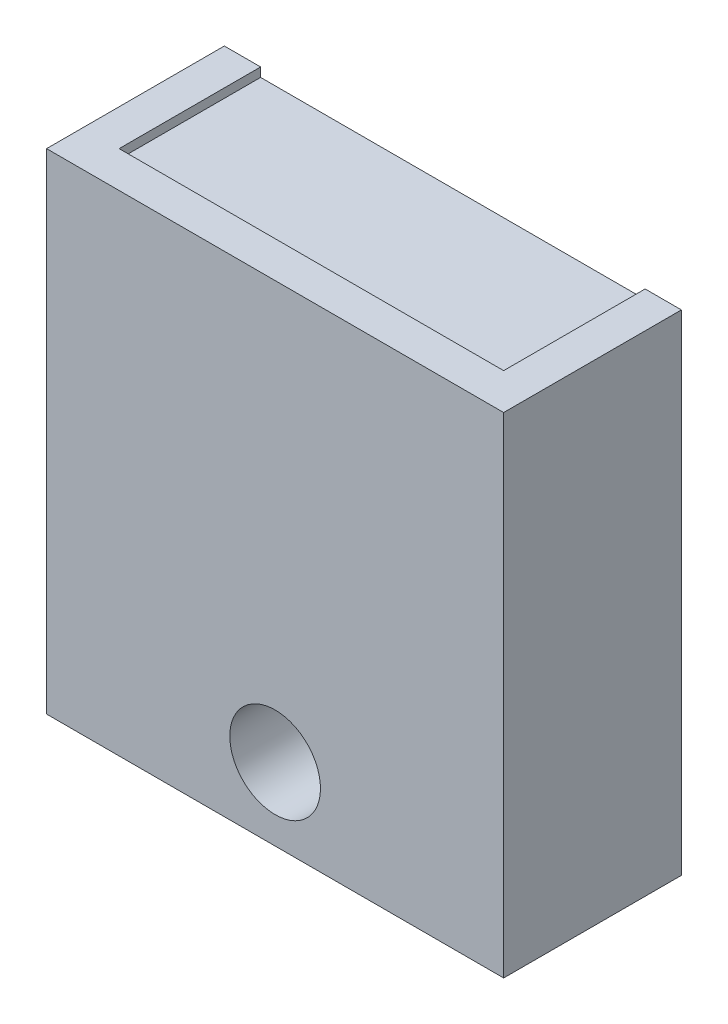
from build123d import *

# Parameters (mm, degrees)
SKETCH2_W            = 25.2
SKETCH2_H            = 27
BOSS_EXTRUDE2_DEPTH  = 2
BOSS_EXTRUDE3_DEPTH  = 7.8
SKETCH8_W            = 2.35
SKETCH8_H            = 8.163083502
SKETCH8_W_2          = 6.497887862
BOSS_EXTRUDE6_DEPTH  = 7.8
SKETCH9_W            = 5
SKETCH9_H            = 8.163083502
SKETCH9_W_2          = 5.002112138
BOSS_EXTRUDE7_DEPTH  = 1.3
SKETCH10_W           = 21.2
SKETCH10_H           = 7.8
CUT_EXTRUDE3_DEPTH   = 0.5
SKETCH12_R           = 1
CUT_EXTRUDE4_DEPTH   = 39.210993183
SKETCH13_R           = 2.5
CUT_EXTRUDE5_DEPTH   = 5.634787343
SKETCH14_W           = 21.2
SKETCH14_H           = 7.8
BOSS_EXTRUDE8_DEPTH  = 1
SKETCH15_W           = 21.2
SKETCH15_H           = 15.836916498
BOSS_EXTRUDE9_DEPTH  = 1.05
SKETCH16_W           = 6.5
SKETCH16_H           = 8.163083502
BOSS_EXTRUDE10_DEPTH = 0.25
SKETCH17_W           = 6.5
SKETCH17_H           = 8.163083502
BOSS_EXTRUDE11_DEPTH = 0.25
SKETCH18_W           = 6.5
SKETCH18_H           = 8.163083502
BOSS_EXTRUDE12_DEPTH = 0.15
SKETCH19_W           = 6.5
SKETCH19_H           = 8.163083502
BOSS_EXTRUDE13_DEPTH = 0.15
SKETCH20_W           = 6.75
SKETCH20_H           = 15.836916498
BOSS_EXTRUDE14_DEPTH = 1
SKETCH21_W           = 6.75
SKETCH21_H           = 15.836916498
BOSS_EXTRUDE15_DEPTH = 1
SKETCH22_W           = 19.2
SKETCH22_H           = 6.75
BOSS_EXTRUDE16_DEPTH = 12


with BuildPart() as part:
    # Sketch2 → Boss-Extrude2 (new body)
    with BuildSketch(Plane.XY):
        with Locations((-12.6, 13.5)):
            Rectangle(SKETCH2_W, SKETCH2_H)
    extrude(amount=BOSS_EXTRUDE2_DEPTH)

    # Sketch3 → Boss-Extrude3 (add)
    with BuildSketch(Plane(origin=(0, 0, 0), x_dir=(-1, 0, 0), z_dir=(0, 0, -1))):
        Polygon((0, 27), (0, 0), (2, 0), (2, 25), (23.2, 25), (23.2, 0), (25.2, 0), (25.2, 27), align=None)
    extrude(amount=BOSS_EXTRUDE3_DEPTH)

    # Sketch8 → Boss-Extrude6 (add)
    with BuildSketch(Plane(origin=(0, 0, 0), x_dir=(-1, 0, 0), z_dir=(0, 0, -1))):
        with Locations((3.175, 4.081541751)):
            Rectangle(SKETCH8_W, SKETCH8_H)
        with Locations((12.598943931, 4.081541751)):
            Rectangle(SKETCH8_W_2, SKETCH8_H)
        with Locations((22.025, 4.081541751)):
            Rectangle(SKETCH8_W, SKETCH8_H)
    extrude(amount=BOSS_EXTRUDE6_DEPTH)

    # Sketch9 → Boss-Extrude7 (add)
    with BuildSketch(Plane(origin=(0, 0, 0), x_dir=(-1, 0, 0), z_dir=(0, 0, -1))):
        with Locations((6.85, 4.081541751)):
            Rectangle(SKETCH9_W, SKETCH9_H)
        with Locations((18.348943931, 4.081541751)):
            Rectangle(SKETCH9_W_2, SKETCH9_H)
    extrude(amount=BOSS_EXTRUDE7_DEPTH)

    # Sketch10 → Cut-Extrude3 (cut)
    with BuildSketch(Plane(origin=(0, 27, 0), x_dir=(1, 0, 0), z_dir=(0, 1, 0))):
        with Locations((-12.6, 3.9)):
            Rectangle(SKETCH10_W, SKETCH10_H)
    extrude(amount=-CUT_EXTRUDE3_DEPTH, mode=Mode.SUBTRACT)

    # Sketch12 → Cut-Extrude4 (cut, through all)
    with BuildSketch(Plane.XY.offset(2)):
        with Locations((-12.6, 4)):
            Circle(SKETCH12_R)
    extrude(amount=-CUT_EXTRUDE4_DEPTH, mode=Mode.SUBTRACT)

    # Sketch13 → Cut-Extrude5 (cut)
    with BuildSketch(Plane.XY.offset(2)):
        with Locations((-12.6, 4)):
            Circle(SKETCH13_R)
    extrude(amount=-CUT_EXTRUDE5_DEPTH, mode=Mode.SUBTRACT)

    # Sketch14 → Boss-Extrude8 (add)
    with BuildSketch(Plane.XZ.offset(-25)):
        with Locations((-12.6, -3.9)):
            Rectangle(SKETCH14_W, SKETCH14_H)
    extrude(amount=BOSS_EXTRUDE8_DEPTH)

    # Sketch15 → Boss-Extrude9 (add)
    with BuildSketch(Plane(origin=(0, 0, 0), x_dir=(-1, 0, 0), z_dir=(0, 0, -1))):
        with Locations((12.6, 16.081541751)):
            Rectangle(SKETCH15_W, SKETCH15_H)
    extrude(amount=BOSS_EXTRUDE9_DEPTH)

    # Sketch16 → Boss-Extrude10 (add)
    with BuildSketch(Plane(origin=(-20.85, 0, 0), x_dir=(0, 0, -1), z_dir=(1, 0, 0))):
        with Locations((4.55, 4.081541751)):
            Rectangle(SKETCH16_W, SKETCH16_H)
    extrude(amount=BOSS_EXTRUDE10_DEPTH)

    # Sketch17 → Boss-Extrude11 (add)
    with BuildSketch(Plane.ZY.offset(4.35)):
        with Locations((-4.55, 4.081541751)):
            Rectangle(SKETCH17_W, SKETCH17_H)
    extrude(amount=BOSS_EXTRUDE11_DEPTH)

    # Sketch18 → Boss-Extrude12 (add)
    with BuildSketch(Plane.ZY.offset(15.847887862)):
        with Locations((-4.55, 4.081541751)):
            Rectangle(SKETCH18_W, SKETCH18_H)
    extrude(amount=BOSS_EXTRUDE12_DEPTH)

    # Sketch19 → Boss-Extrude13 (add)
    with BuildSketch(Plane(origin=(-9.35, 0, 0), x_dir=(0, 0, -1), z_dir=(1, 0, 0))):
        with Locations((4.55, 4.081541751)):
            Rectangle(SKETCH19_W, SKETCH19_H)
    extrude(amount=BOSS_EXTRUDE13_DEPTH)

    # Sketch20 → Boss-Extrude14 (add)
    with BuildSketch(Plane(origin=(-23.2, 0, 0), x_dir=(0, 0, -1), z_dir=(1, 0, 0))):
        with Locations((4.425, 16.081541751)):
            Rectangle(SKETCH20_W, SKETCH20_H)
    extrude(amount=BOSS_EXTRUDE14_DEPTH)

    # Sketch21 → Boss-Extrude15 (add)
    with BuildSketch(Plane.ZY.offset(2)):
        with Locations((-4.425, 16.081541751)):
            Rectangle(SKETCH21_W, SKETCH21_H)
    extrude(amount=BOSS_EXTRUDE15_DEPTH)

    # Sketch22 → Boss-Extrude16 (add)
    with BuildSketch(Plane.XZ.offset(-24)):
        with Locations((-12.6, -4.425)):
            Rectangle(SKETCH22_W, SKETCH22_H)
    extrude(amount=BOSS_EXTRUDE16_DEPTH)


solid = part.part
